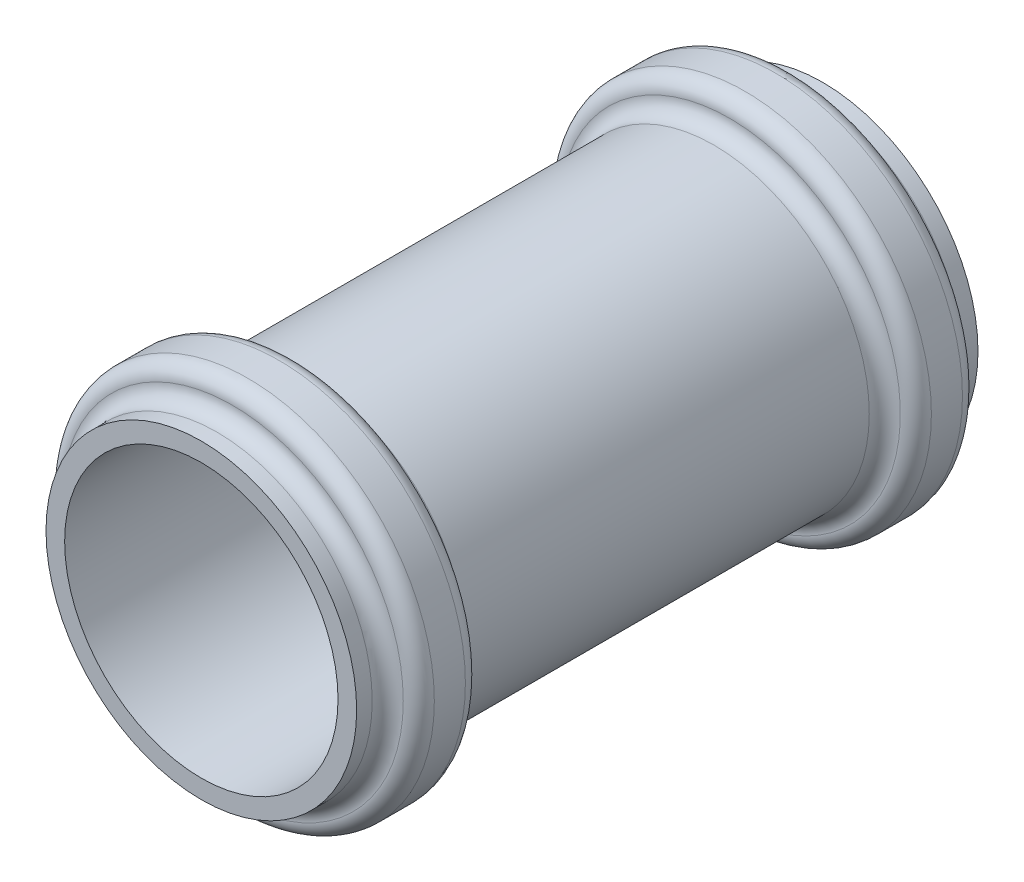
from build123d import *

# Parameters (mm, degrees)
SKETCH_1_R             = 25
SKETCH_1_R_2           = 22
EXTRUDE_1_DEPTH        = 100
EXTRUDE_START          = -15
SKETCH_2_R             = 30
SKETCH_2_R_2           = 25
EXTRUDE_2_DEPTH        = 10
FILLET_1_R             = 2.5
FILLET_1_OF_MIRROR_1_R = 2.5


with BuildPart() as part:
    # Эскиз1 → Бобышка-Вытянуть1 (new body)
    with BuildSketch(Plane.XY):
        Circle(SKETCH_1_R)
        Circle(SKETCH_1_R_2, mode=Mode.SUBTRACT)
    extrude(amount=EXTRUDE_1_DEPTH)

    # Эскиз2 → Бобышка-Вытянуть2 (add)
    with BuildSketch(Plane.XY.offset(100).offset(EXTRUDE_START)):
        Circle(SKETCH_2_R)
        Circle(SKETCH_2_R_2, mode=Mode.SUBTRACT)
    extrude_2 = extrude(amount=EXTRUDE_2_DEPTH)

    # Скругление1
    fillet_1_edges = [part.edges().sort_by_distance(p)[0] for p in [
        (-25, 0, 85),
        (-25, 0, 95),
        (-30, 0, 85),
        (-30, 0, 95),
    ]]
    fillet(fillet_1_edges, radius=FILLET_1_R - 0.0001)  # a hair under: the kernel refuses the full size

    # Зеркальное отражение1: Бобышка-Вытянуть2 across plane
    add(extrude_2.mirror(Plane.XY.offset(50)))

    # Скругление1 of Зеркальное отражение1
    fillet_1_of_mirror_1_edges = [part.edges().sort_by_distance(p)[0] for p in [
        (-25, 0, 15),
        (-25, 0, 5),
        (-30, 0, 15),
        (-30, 0, 5),
    ]]
    fillet(fillet_1_of_mirror_1_edges, radius=FILLET_1_OF_MIRROR_1_R - 0.0001)  # a hair under: the kernel refuses the full size


solid = part.part
